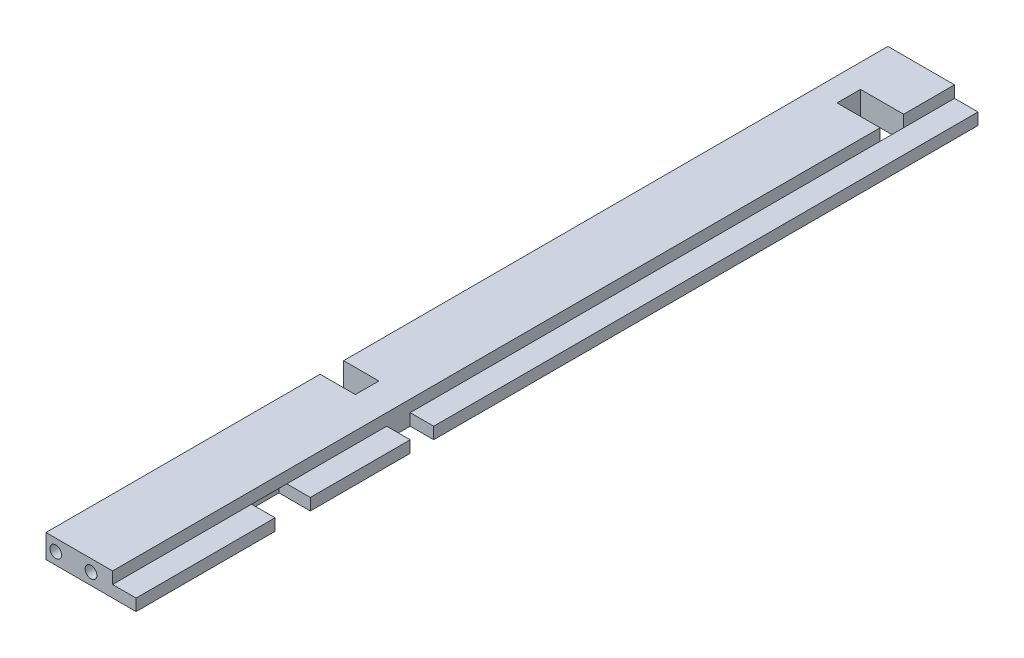
from build123d import *

# Parameters (mm, degrees)
BOSS_EXTRU_1_DEPTH         = 215
ESQUISSE3_W                = 8
ESQUISSE3_H                = 9
ESQUISSE3_W_2              = 9
ENL_V_MAT_EXTRU_1_DEPTH    = 3
ESQUISSE4_W                = 9
ESQUISSE4_H                = 6
ENL_V_MAT_EXTRU_2_DEPTH    = 217.309962785
ESQUISSE5_W                = 6
ESQUISSE5_H                = 6
ENL_V_MAT_EXTRU_3_DEPTH    = 3
ESQUISSE8_R                = 1.5
ENL_V_MAT_EXTRU_4_DEPTH    = 10
R_P_TITION_LIN_AIRE1_COUNT = 2
R_P_TITION_LIN_AIRE1_PITCH = 9
ESQUISSE9_W                = 11
ESQUISSE9_H                = 6
ENL_V_MAT_EXTRU_5_DEPTH    = 217.309962785


with BuildPart() as part:
    # Esquisse1 → Boss.-Extru.1 (new body)
    with BuildSketch(Plane.XY):
        Polygon((0, 0), (0, 6), (17, 6), (17, 3), (23, 3), (23, 0), align=None)
    extrude(amount=BOSS_EXTRU_1_DEPTH)

    # Esquisse3 → Enlèv. mat.-Extru.1 (cut)
    with BuildSketch(Plane.XZ):
        with Locations((19, 175)):
            Rectangle(ESQUISSE3_W, ESQUISSE3_H)
        with Locations((4.5, 175)):
            Rectangle(ESQUISSE3_W_2, ESQUISSE3_H)
    extrude(amount=-ENL_V_MAT_EXTRU_1_DEPTH, mode=Mode.SUBTRACT)

    # Esquisse4 → Enlèv. mat.-Extru.2 (cut, through all)
    with BuildSketch(Plane.XZ):
        with Locations((4.5, 142.000000283)):
            Rectangle(ESQUISSE4_W, ESQUISSE4_H)
    extrude(amount=-ENL_V_MAT_EXTRU_2_DEPTH, mode=Mode.SUBTRACT)

    # Esquisse5 → Enlèv. mat.-Extru.3 (cut)
    with BuildSketch(Plane.XZ):
        with Locations((20, 142.000000283)):
            Rectangle(ESQUISSE5_W, ESQUISSE5_H)
    extrude(amount=-ENL_V_MAT_EXTRU_3_DEPTH, mode=Mode.SUBTRACT)

    # Esquisse8 → Enlèv. mat.-Extru.4 (cut)
    with BuildSketch(Plane.XY.offset(215)):
        with Locations((2.5, 3)):
            Circle(ESQUISSE8_R)
    enl_v_mat_extru_4 = extrude(amount=-ENL_V_MAT_EXTRU_4_DEPTH, mode=Mode.SUBTRACT)

    # Répétition linéaire1: Enlèv. mat.-Extru.4 ×2
    with Locations(*[(i * R_P_TITION_LIN_AIRE1_PITCH, 0, 0) for i in range(1, R_P_TITION_LIN_AIRE1_COUNT)]):
        add(enl_v_mat_extru_4, mode=Mode.SUBTRACT)

    # Esquisse9 → Enlèv. mat.-Extru.5 (cut, through all)
    with BuildSketch(Plane(origin=(0, 6, 0), x_dir=(1, 0, 0), z_dir=(0, 1, 0))):
        with Locations((11.5, -16.000000283)):
            Rectangle(ESQUISSE9_W, ESQUISSE9_H)
    extrude(amount=-ENL_V_MAT_EXTRU_5_DEPTH, mode=Mode.SUBTRACT)


solid = part.part
